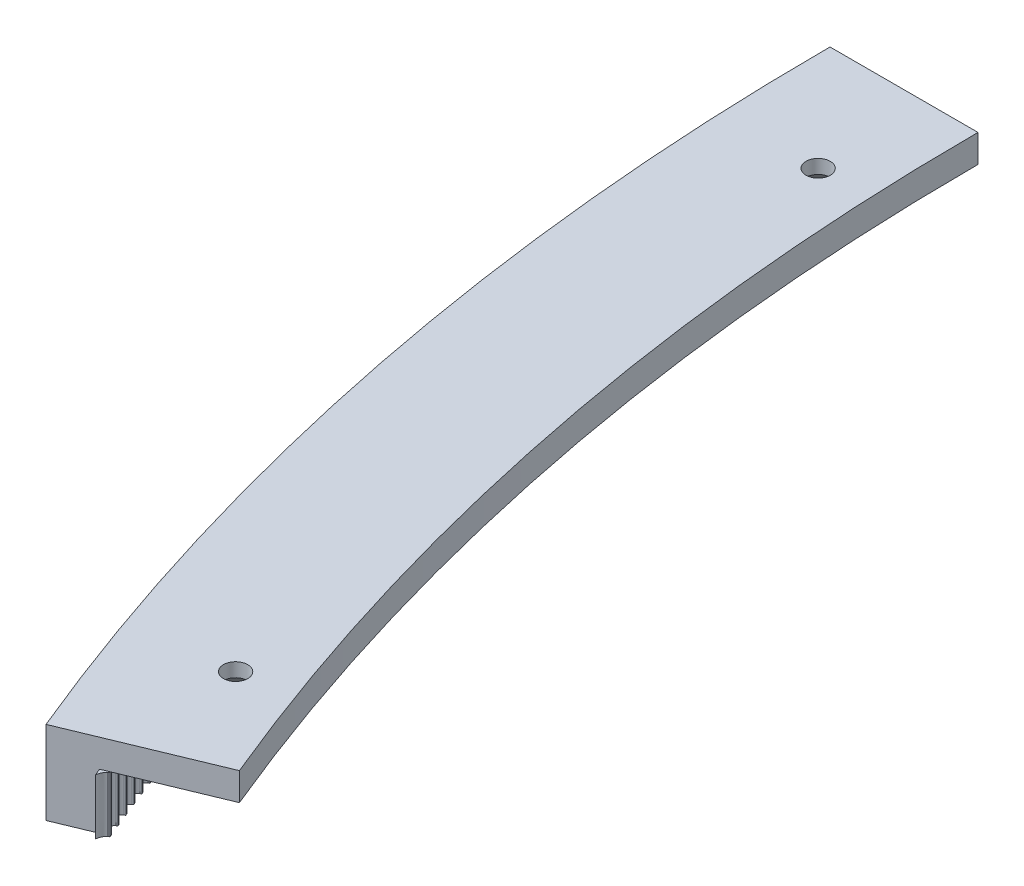
from build123d import *

# Parameters (mm, degrees)
REVOLVE1_ANGLE      = 22.5
SKETCH7_R           = 2.0828
CUT_EXTRUDE1_DEPTH  = 470.992662332
BOSS_EXTRUDE1_DEPTH = 9.525
CIRPATTERN1_COUNT   = 70
CIRPATTERN1_ANGLE   = 22.5
CHAMFER1_SIZE       = 2.38


with BuildPart() as part:
    # Sketch3 → Revolve1 (revolve)
    with BuildSketch(Plane.XY):
        Polygon((-413.458945356, -4.7625), (-438.858945356, -4.7625), (-438.858945356, -19.05), (-431.238945356, -19.05), (-431.238945356, -9.525), (-424.888945356, -9.525), (-413.458945356, -9.525), align=None)
    revolve(axis=Axis((0, 0, 0), (0, 1, 0)), revolution_arc=REVOLVE1_ANGLE)

    # Sketch7 → Cut-Extrude1 (cut, through all)
    with BuildSketch(Plane.XZ.offset(9.525)):
        with Locations((-421.845081902, 19.05)):
            Circle(SKETCH7_R)
        with Locations((-397.024156446, 143.833218774)):
            Circle(SKETCH7_R)
    extrude(amount=-CUT_EXTRUDE1_DEPTH, mode=Mode.SUBTRACT)

    # Sketch10 → Boss-Extrude1 (add)
    with BuildSketch(Plane.XZ.offset(9.525)):
        with BuildLine():
            Line((-430.619858611, -0.2318647), (-430.363418999, -0.218425269))
            ThreePointArc((-430.363418999, -0.218425269), (-430.364172936, -0.011342181), (-430.352582064, 0.195417645))
            Line((-430.352582064, 0.195417645), (-430.60796686, 0.222259763))
            add(Edge.make_bspline(
                [(-431.821806221, 1.301428955), (-431.538223941, 0.750519915), (-431.13342356, 0.390796464), (-430.60796686, 0.222259763)],
                knots=[0.069617967, 0.069617967, 0.069617967, 0.069617967, 1, 1, 1, 1], degree=3))
            ThreePointArc((-431.821806221, 1.301428955), (-431.825713046, 0.081022483), (-431.822722096, -1.139386577))
            add(Edge.make_bspline(
                [(-431.822722096, -1.139386577), (-431.517882375, -0.665548591), (-431.117134616, -0.363088442), (-430.619858611, -0.2318647)],
                knots=[0.132959125, 0.132959125, 0.132959125, 0.132959125, 1, 1, 1, 1], degree=3))
        make_face()
    boss_extrude1 = extrude(amount=BOSS_EXTRUDE1_DEPTH)

    # CirPattern1: Boss-Extrude1 ×70 about axis
    cirpattern1_axis = Axis((0, -9.525, 0), (0, 1, 0))
    for i in range(1, CIRPATTERN1_COUNT):
        add(boss_extrude1.rotate(cirpattern1_axis, i * CIRPATTERN1_ANGLE / (CIRPATTERN1_COUNT - 1)))

    # Chamfer1
    chamfer1_edges = [part.edges().sort_by_distance(p)[0] for p in [
        (-423.927881902, -9.525, 19.05),
        (-399.106956446, -9.525, 143.833218774),
    ]]
    chamfer(chamfer1_edges, length=CHAMFER1_SIZE)


solid = part.part
